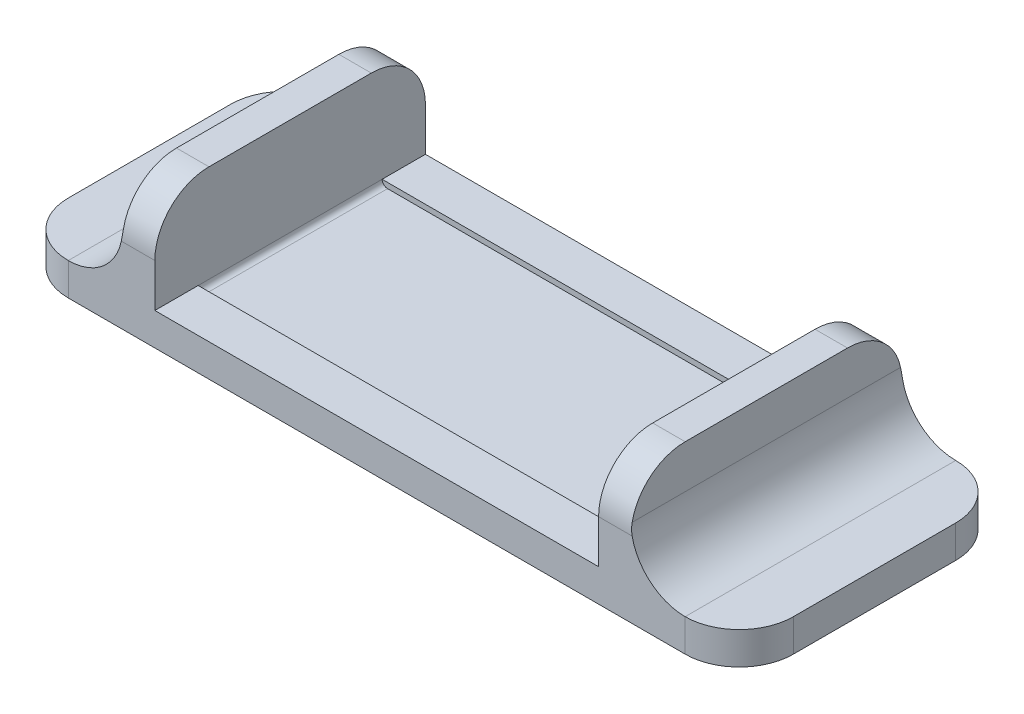
from build123d import *

# Parameters (mm, degrees)
BOSS_EXTRUDE1_DEPTH = 50
FILLET1_R           = 10
FILLET2_R           = 10
SKETCH2_W           = 82
SKETCH2_H           = 34
CUT_EXTRUDE1_DEPTH  = 1
FILLET3_R           = 1


with BuildPart() as part:
    # Sketch1 → Boss-Extrude1 (new body)
    with BuildSketch(Plane.XY):
        Polygon((0, 0), (82, 0), (82, 18), (88, 18), (88, 0), (108, 0), (108, -6), (0, -6), (-6, -6), (-26, -6), (-26, 0), (-6, 0), (-6, 18), (0, 18), align=None)
    extrude(amount=BOSS_EXTRUDE1_DEPTH)

    # Fillet1
    fillet1_edges = [part.edges().sort_by_distance(p)[0] for p in [
        (88, 0, 25),
        (-6, 0, 25),
        (108, -3, 0),
        (108, -3, 50),
        (-26, -3, 0),
        (-26, -3, 50),
    ]]
    fillet(fillet1_edges, radius=FILLET1_R - 0.0001)  # a hair under: the kernel refuses the full size

    # Fillet2
    fillet2_edges = [part.edges().sort_by_distance(p)[0] for p in [
        (85, 18, 50),
        (85, 18, 0),
        (-3, 18, 0),
        (-3, 18, 50),
    ]]
    fillet(fillet2_edges, radius=FILLET2_R)

    # Sketch2 → Cut-Extrude1 (cut)
    with BuildSketch(Plane(origin=(0, 0, 0), x_dir=(1, 0, 0), z_dir=(0, 1, 0))):
        with Locations((41, -25)):
            Rectangle(SKETCH2_W, SKETCH2_H)
    extrude(amount=-CUT_EXTRUDE1_DEPTH, mode=Mode.SUBTRACT)

    # Fillet3
    fillet3_edges = [part.edges().sort_by_distance(p)[0] for p in [
        (82, -1, 25),
        (0, -1, 25),
    ]]
    fillet(fillet3_edges, radius=FILLET3_R)


solid = part.part
